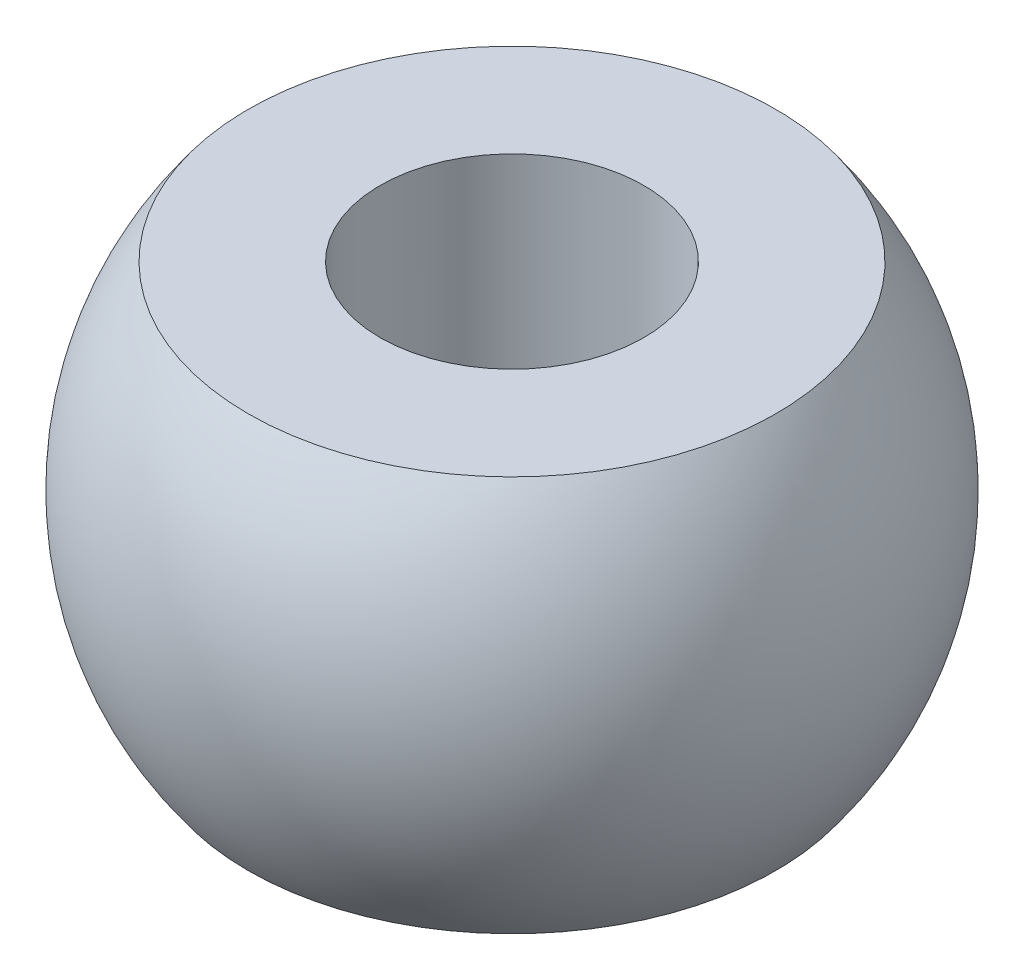
from build123d import *

# Parameters (mm, degrees)
CUT_EXTRUDE1_DEPTH      = 9.660254038
CUT_EXTRUDE1_DEPTH_BACK = 9.660254038
SKETCH2_R               = 2
MIRROR1_START           = -4.582575795
MIRROR1_OUTLINE_W       = 10
MIRROR1_OUTLINE_H       = 10
MIRROR1_OUTLINE_R       = 2
MIRROR1_DEPTH           = 1.582575795


# Read off the part's stored shape, not the designer's step: Mirror1
with BuildPart() as part:
    # Sketch1 → Revolve1 (revolve)
    with BuildSketch(Plane(origin=(0, 0, 0), x_dir=(1, 0, 0), z_dir=(0, 1, 0))):
        with BuildLine():
            Line((-5, 0), (5, 0))
            ThreePointArc((5, 0), (0, 5), (-5, 0))
        make_face()
    revolve(axis=Axis((-5, 0, 0), (1, 0, 0)))

    # Sketch2 → Cut-Extrude1 (cut, two sides: drawn at the far end of the back side and taken through both)
    with BuildSketch(Plane(origin=(0, 0, 0), x_dir=(1, 0, 0), z_dir=(0, 1, 0)).offset(-CUT_EXTRUDE1_DEPTH_BACK)):
        with Locations(Location((0, 0, 0), (0, 0, 90))):
            Circle(SKETCH2_R)
    extrude(amount=CUT_EXTRUDE1_DEPTH + CUT_EXTRUDE1_DEPTH_BACK, mode=Mode.SUBTRACT)

    # SurfaceCut1
    split(bisect_by=Plane(origin=(0, 3, 0), x_dir=(1, 0, 0), z_dir=(0, 1, 0)), keep=Keep.BOTTOM)

    # Mirror1 outline → Mirror1 (cut)
    with BuildSketch(Plane(origin=(0, 0, 0), x_dir=(1, 0, 0), z_dir=(0, 1, 0)).offset(MIRROR1_START)):
        Rectangle(MIRROR1_OUTLINE_W, MIRROR1_OUTLINE_H)
        Circle(MIRROR1_OUTLINE_R, mode=Mode.SUBTRACT)
    extrude(amount=MIRROR1_DEPTH, mode=Mode.SUBTRACT)


solid = part.part
